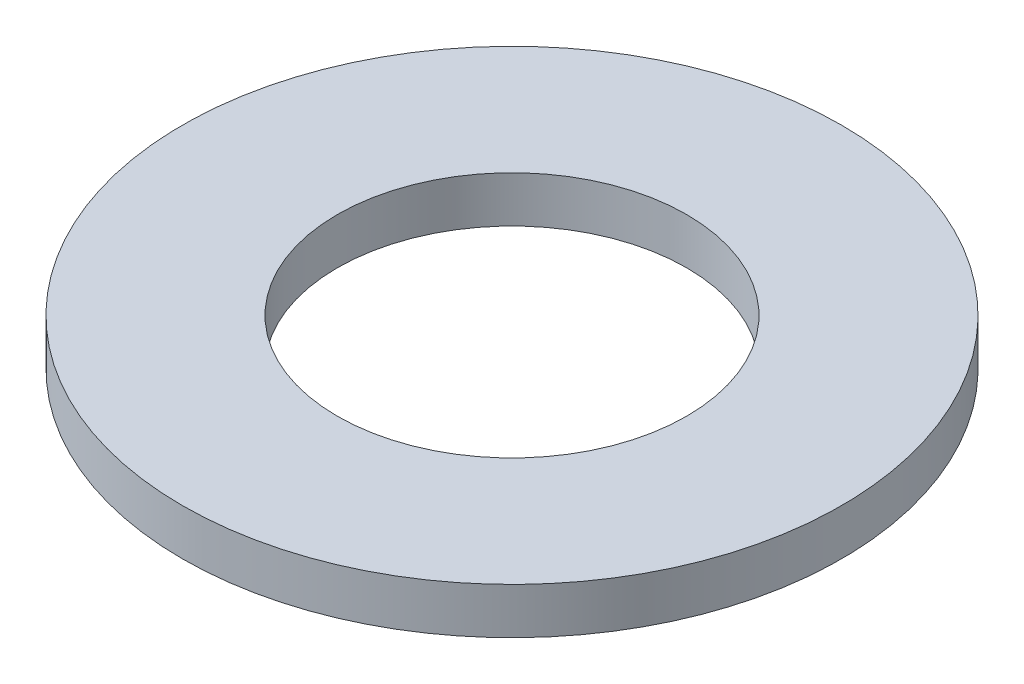
from build123d import *

# Parameters (mm, degrees)
SKETCH1_R           = 6.35
BOSS_EXTRUDE1_DEPTH = 0.889
SKETCH5_R           = 3.3655
CUT_EXTRUDE1_DEPTH  = 10.024152093


with BuildPart() as part:
    # Sketch1 → Boss-Extrude1 (new body)
    with BuildSketch(Plane(origin=(0, 0, 0), x_dir=(1, 0, 0), z_dir=(0, 1, 0))):
        Circle(SKETCH1_R)
    extrude(amount=BOSS_EXTRUDE1_DEPTH)

    # Sketch5 → Cut-Extrude1 (cut, through all)
    with BuildSketch(Plane(origin=(0, 0.889, 0), x_dir=(-1, 0, 0), z_dir=(0, 1, 0))):
        Circle(SKETCH5_R)
    extrude(amount=-CUT_EXTRUDE1_DEPTH, mode=Mode.SUBTRACT)


solid = part.part
